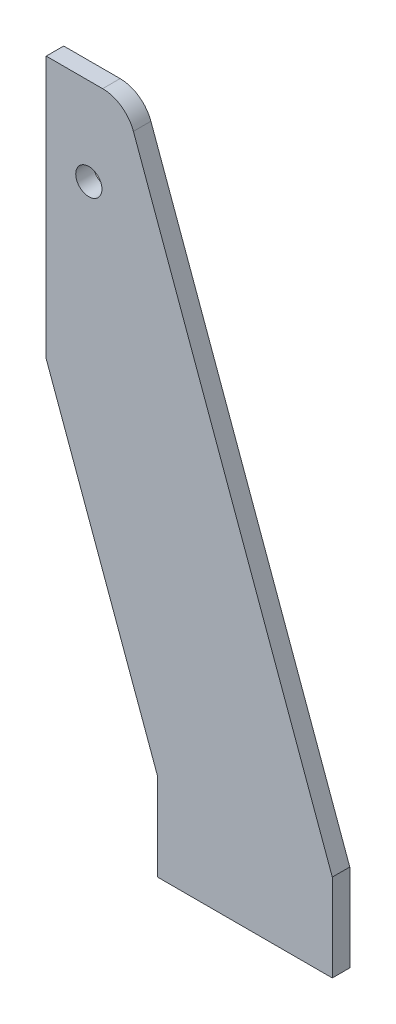
from build123d import *

# Parameters (mm, degrees)
SALIENTE_EXTRUIR1_DEPTH                        = 8
CROQUIS2_R                                     = 6
CORTAR_EXTRUIR1_DEPTH                          = 311.586541885
PERFORADOR_PARA_ROSCAR_PARA_MACHO_DE_ROS_D     = 3.3
PERFORADOR_PARA_ROSCAR_PARA_MACHO_DE_ROS_DEPTH = 7
PERFORADOR_PARA_ROSCAR_PARA_MACHO_DE_ROS_TIP   = 0.991420021


with BuildPart() as part:
    # Croquis1 → Saliente-Extruir1 (new body)
    with BuildSketch(Plane.XY):
        with BuildLine():
            Line((80, 0), (80, 40))
            Line((80, 40), (-11.039984671, 290.13030215))
            ThreePointArc((-11.039984671, 290.13030215), (-16.531727437, 297.287280664), (-25.135373982, 300))
            Line((-25.135373982, 300), (-50.955832797, 300))
            Line((-50.955832797, 300), (-50.955832797, 180))
            Line((-50.955832797, 180), (0, 40))
            Line((0, 40), (0, 0))
            Line((0, 0), (80, 0))
        make_face()
    extrude(amount=SALIENTE_EXTRUIR1_DEPTH)

    # Croquis2 → Cortar-Extruir1 (cut, through all)
    with BuildSketch(Plane(origin=(0, 0, 0), x_dir=(-1, 0, 0), z_dir=(0, 0, -1))):
        with Locations((31.455832797, 260)):
            Circle(CROQUIS2_R)
    extrude(amount=-CORTAR_EXTRUIR1_DEPTH, mode=Mode.SUBTRACT)

    # Perforador para roscar para macho de roscar para M44
    with Locations(Plane(origin=(0, 0, 0), x_dir=(-1, 0, 0), z_dir=(0, 0, -1))):
        with Locations((31.455832797, 241.75), (31.455832797, 278.25)):
            Hole(PERFORADOR_PARA_ROSCAR_PARA_MACHO_DE_ROS_D / 2, depth=PERFORADOR_PARA_ROSCAR_PARA_MACHO_DE_ROS_DEPTH)
            with Locations((0, 0, -(PERFORADOR_PARA_ROSCAR_PARA_MACHO_DE_ROS_DEPTH + PERFORADOR_PARA_ROSCAR_PARA_MACHO_DE_ROS_TIP / 2))):  # 118° drill point
                Cone(0, PERFORADOR_PARA_ROSCAR_PARA_MACHO_DE_ROS_D / 2, PERFORADOR_PARA_ROSCAR_PARA_MACHO_DE_ROS_TIP, mode=Mode.SUBTRACT)


solid = part.part
